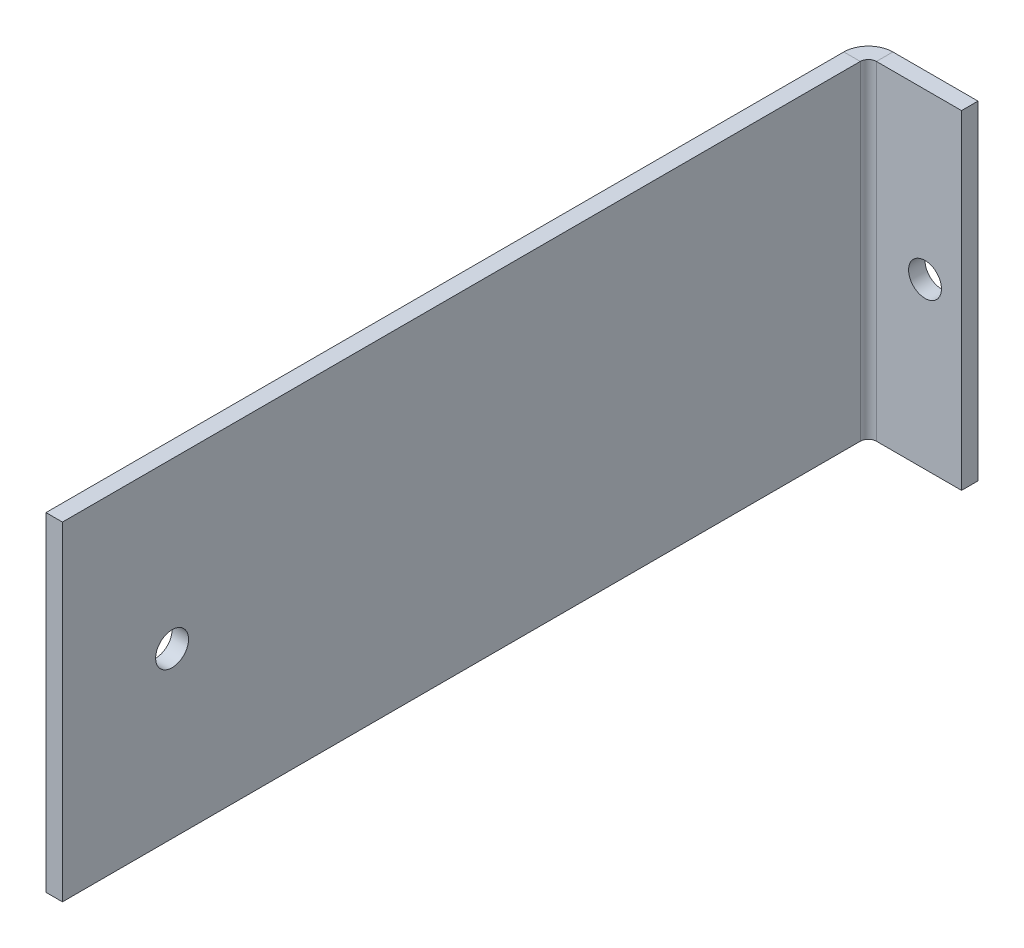
from build123d import *

# Parameters (mm, degrees)
BASE_FLANGE1_DEPTH              = 30
F_3_0MM_PRESS_DOWEL_HOLE1_D     = 3
F_3_0MM_PRESS_DOWEL_HOLE2_D     = 3
F_3_0MM_PRESS_DOWEL_HOLE3_D     = 3
F_3_0MM_PRESS_DOWEL_HOLE3_DEPTH = 6
F_3_0MM_PRESS_DOWEL_HOLE3_TIP   = 0.901290929


# Sheet-metal steps are written as plain solids
with BuildPart() as part:
    # Sketch2 → Base-Flange1 (new body)
    with BuildSketch(Plane(origin=(0, 0, 0), x_dir=(1, 0, 0), z_dir=(0, 1, 0))):
        with BuildLine():
            Line((0, 0), (0, 72.7634))
            ThreePointArc((0, 72.7634), (0.655084973, 74.344915027), (2.2366, 75))
            Line((2.2366, 75), (10, 75))
            Line((10, 75), (10, 73.5))
            Line((10, 73.5), (2.2366, 73.5))
            ThreePointArc((2.2366, 73.5), (1.715745145, 73.284254855), (1.5, 72.7634))
            Line((1.5, 72.7634), (1.5, 0))
            Line((1.5, 0), (0, 0))
        make_face()
    extrude(amount=BASE_FLANGE1_DEPTH)

    # Ø3.0mm Press Dowel Hole1 (through all)
    with Locations(Plane(origin=(0, 0, -75), x_dir=(-1, 0, 0), z_dir=(0, 0, -1))):
        with Locations((-6.667186687, 15)):
            Hole(F_3_0MM_PRESS_DOWEL_HOLE1_D / 2)

    # Ø3.0mm Press Dowel Hole2 (through all)
    with Locations(Plane.ZY):
        with Locations((-10, 15)):
            Hole(F_3_0MM_PRESS_DOWEL_HOLE2_D / 2)

    # Ø3.0mm Press Dowel Hole3
    with Locations(Plane(origin=(-82.525513363, 241.531359221, -81), x_dir=(1, 0, 0), z_dir=(0, 0, -1))):
        with Locations((220.525513363, 156.531359221), (102.525513363, 181.531359221), (102.525513363, 271.531359221), (89.19270005, 226.531359221), (210.525513363, 317.793651488), (230.525513363, 317.793651488), (252.525513363, 320.462332131), (232.525513363, 300.462332131), (252.525513363, 132.600386311), (232.525513363, 152.600386311), (111.286271896, 136.531359221), (91.286271896, 136.531359221), (41.525513363, 196.432813402), (13.525513363, 196.432813402), (41.525513363, 138.767959221), (13.525513363, 138.767959221), (41.525513363, 256.62990504), (13.525513363, 256.62990504), (41.525513363, 314.294759221), (13.525513363, 314.294759221)):
            Hole(F_3_0MM_PRESS_DOWEL_HOLE3_D / 2, depth=F_3_0MM_PRESS_DOWEL_HOLE3_DEPTH)
            with Locations((0, 0, -(F_3_0MM_PRESS_DOWEL_HOLE3_DEPTH + F_3_0MM_PRESS_DOWEL_HOLE3_TIP / 2))):  # 118° drill point
                Cone(0, F_3_0MM_PRESS_DOWEL_HOLE3_D / 2, F_3_0MM_PRESS_DOWEL_HOLE3_TIP, mode=Mode.SUBTRACT)


solid = part.part
